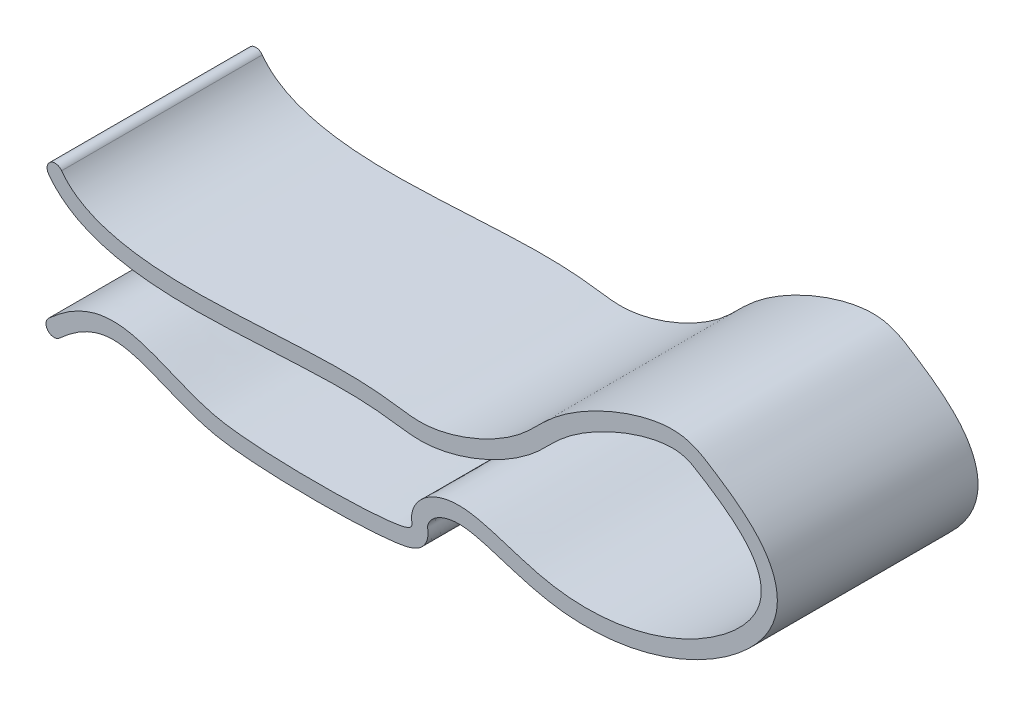
from build123d import *

# Parameters (mm, degrees)
BOSS_EXTRUDE3_DEPTH = 15


with BuildPart() as part:
    # Sketch1 → Boss-Extrude3 (new body)
    with BuildSketch(Plane.XY):
        with BuildLine():
            ThreePointArc((-11.240441686, -2.88718836), (-12.088046018, -2.847604333), (-12.048461991, -2))
            add(Edge.make_bspline(
                [(-12.048461991, -2), (-7.575841319, 2.073507366), (-4.411939934, -0.741747592), (2.808298277, -2.818086317), (15.434353957, -2.703171457), (14.647674918, -0.462971694), (17.494029434, 2.481429577), (29.874773501, -2.917587348), (45.758970095, 5.965576815), (38.788106629, 10.905496789), (34.285238116, 13.672156099), (27.602812268, 11.021898075), (23.096957155, 5.927263227), (17.310223743, 3.557225001), (10.86692298, 4.688622988), (4.354143166, 4.00585238), (-9.437829601, 3.72218449), (-12.048461991, 7.324863972)],
                knots=[0, 0, 0, 0, 0.061998061, 0.06941494, 0.104581346, 0.116779498, 0.187000651, 0.22780491, 0.36883162, 0.522690656, 0.549819312, 0.630084974, 0.650122572, 0.730157696, 0.75596056, 0.88234835, 1, 1, 1, 1], degree=3))
            ThreePointArc((-12.048461991, 7.324863972), (-11.914676485, 8.162778907), (-11.07676155, 8.028993401))
            add(Edge.make_bspline(
                [(-11.240441686, -2.88718836), (-11.115700115, -2.773578075), (-10.85511482, -2.545518489), (-10.369058628, -2.156268421), (-9.790271462, -1.75705421), (-9.150748325, -1.41132086), (-8.358829888, -1.099622032), (-7.457471272, -0.940860678), (-6.378551248, -1.015586335), (-5.208761582, -1.322401275), (-3.921952302, -1.812726982), (-2.741427112, -2.305732109), (-1.713108192, -2.703219858), (-0.912564645, -2.98520517), (-0.008463782, -3.255679382), (1.537754213, -3.55265967), (4.183489436, -3.770587066), (7.91294406, -3.858997688), (10.914267194, -3.794735267), (12.915774334, -3.667064697), (14.142988086, -3.529583988), (14.91515048, -3.376398856), (15.470461028, -3.148632827), (15.91075248, -2.842179407), (16.259704618, -2.288463469), (16.324308192, -1.76099487), (16.287858662, -1.468592542), (16.27989459, -1.409988539), (16.278833705, -1.38576367), (16.278693177, -1.33685431), (16.285593426, -1.272536999), (16.307096852, -1.181004729), (16.357686571, -1.044774883), (16.467954641, -0.851979423), (16.6876442, -0.608526655), (17.101684782, -0.299238594), (17.864805898, 0.001599447), (19.13741383, 0.063655702), (20.989680687, -0.410384279), (23.239685303, -1.168158186), (25.722841271, -1.768713914), (28.159677223, -1.932244749), (30.515398417, -1.766169067), (33.49562538, -1.160653104), (36.836300159, 0.173424044), (39.971873823, 2.303717275), (41.678457752, 4.260546841), (42.34786183, 5.90769229), (42.515868426, 7.582496806), (41.828582623, 9.438661255), (40.575915364, 10.81784906), (39.433009113, 11.768484685), (38.542841983, 12.415058719), (37.63672143, 12.999939704), (36.829785145, 13.549392612), (35.696493713, 14.050627773), (34.554307447, 14.13449067), (33.384597227, 14.044292972), (31.795285835, 13.681127978), (29.769365925, 12.926289082), (27.75440506, 11.904750931), (26.212277935, 10.879793154), (25.123790122, 9.945989811), (24.222064408, 9.036452786), (23.262146703, 8.108868074), (21.768548205, 7.092910205), (19.580062292, 5.959581208), (17.587921075, 5.344214736), (16.169371635, 5.173657687), (15.343101516, 5.155270793), (14.353849593, 5.281687022), (13.005253506, 5.466738779), (11.272610339, 5.593138182), (9.089543275, 5.615733703), (6.253036252, 5.492234078), (2.972402065, 5.314150216), (-1.061817472, 5.127915396), (-5.292422213, 5.271811955), (-8.351311219, 5.986296205), (-10.152712819, 7.006190037), (-10.803561687, 7.65197688), (-11.07676155, 8.028993401)],
                knots=[0, 0, 0, 0, 0.001953125, 0.00390625, 0.0078125, 0.01171875, 0.015625, 0.0234375, 0.03125, 0.0390625, 0.046875, 0.0546875, 0.05859375, 0.0625, 0.06640625, 0.0703125, 0.078125, 0.0859375, 0.09375, 0.09765625, 0.1015625, 0.10546875, 0.107421875, 0.109375, 0.111328125, 0.11328125, 0.115234375, 0.1171875, 0.119140625, 0.12109375, 0.125, 0.12890625, 0.1328125, 0.140625, 0.1484375, 0.15625, 0.171875, 0.1875, 0.203125, 0.21875, 0.234375, 0.25, 0.265625, 0.28125, 0.3125, 0.34375, 0.375, 0.390625, 0.40625, 0.4375, 0.46875, 0.484375, 0.5, 0.515625, 0.53125, 0.546875, 0.5546875, 0.5625, 0.578125, 0.59375, 0.609375, 0.625, 0.6328125, 0.640625, 0.65625, 0.671875, 0.6875, 0.71875, 0.7265625, 0.734375, 0.75, 0.765625, 0.78125, 0.8125, 0.84375, 0.875, 0.90625, 0.9375, 0.96875, 0.984375, 1, 1, 1, 1], degree=3))
        make_face()
    extrude(amount=BOSS_EXTRUDE3_DEPTH)


solid = part.part
